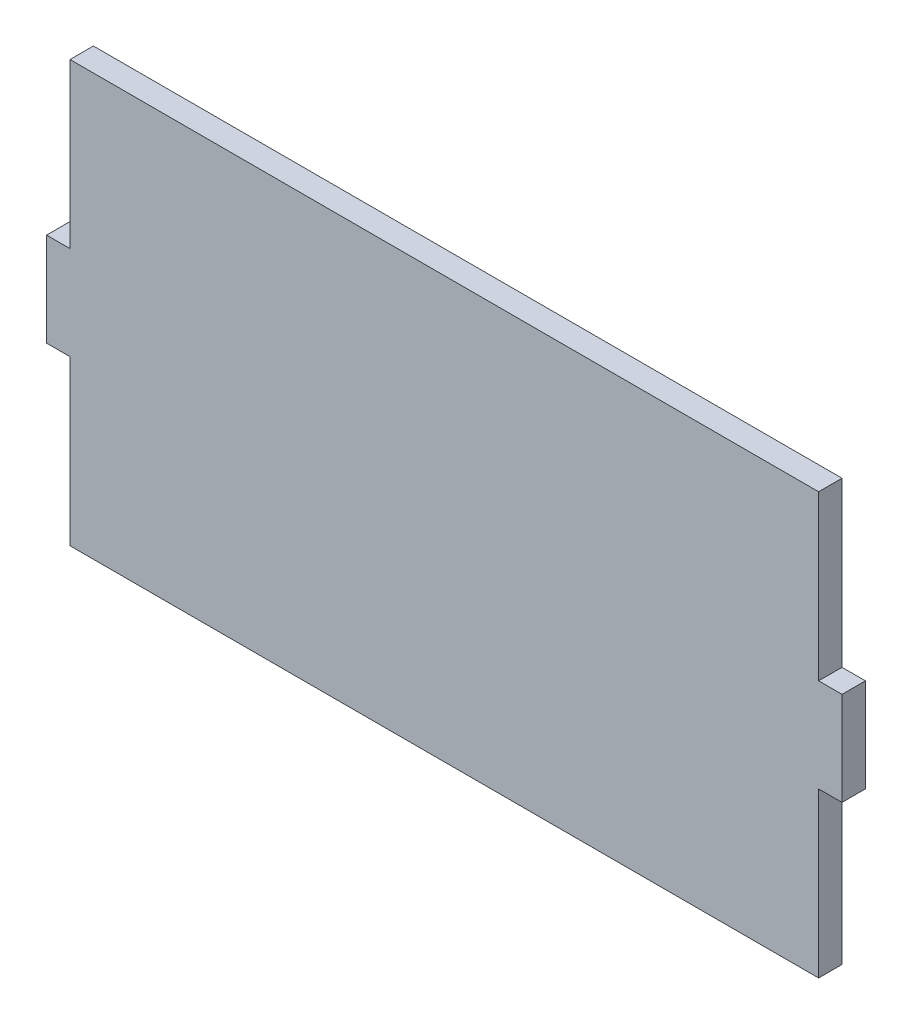
from build123d import *

# Parameters (mm, degrees)
SKETCH1_W           = 101.6
SKETCH1_H           = 57.15
BOSS_EXTRUDE1_DEPTH = 3.175
SKETCH2_W           = 3.175
SKETCH2_H           = 12.7
BOSS_EXTRUDE2_DEPTH = 3.175


with BuildPart() as part:
    # Sketch1 → Boss-Extrude1 (new body)
    with BuildSketch(Plane.XY):
        with Locations((50.8, 28.575)):
            Rectangle(SKETCH1_W, SKETCH1_H)
    extrude(amount=BOSS_EXTRUDE1_DEPTH)

    # Sketch2 → Boss-Extrude2 (add)
    with BuildSketch(Plane.XY.offset(3.175)):
        with Locations((-1.5875, 28.575)):
            Rectangle(SKETCH2_W, SKETCH2_H)
        with Locations((103.1875, 28.575)):
            Rectangle(SKETCH2_W, SKETCH2_H)
    extrude(amount=-BOSS_EXTRUDE2_DEPTH)


solid = part.part
